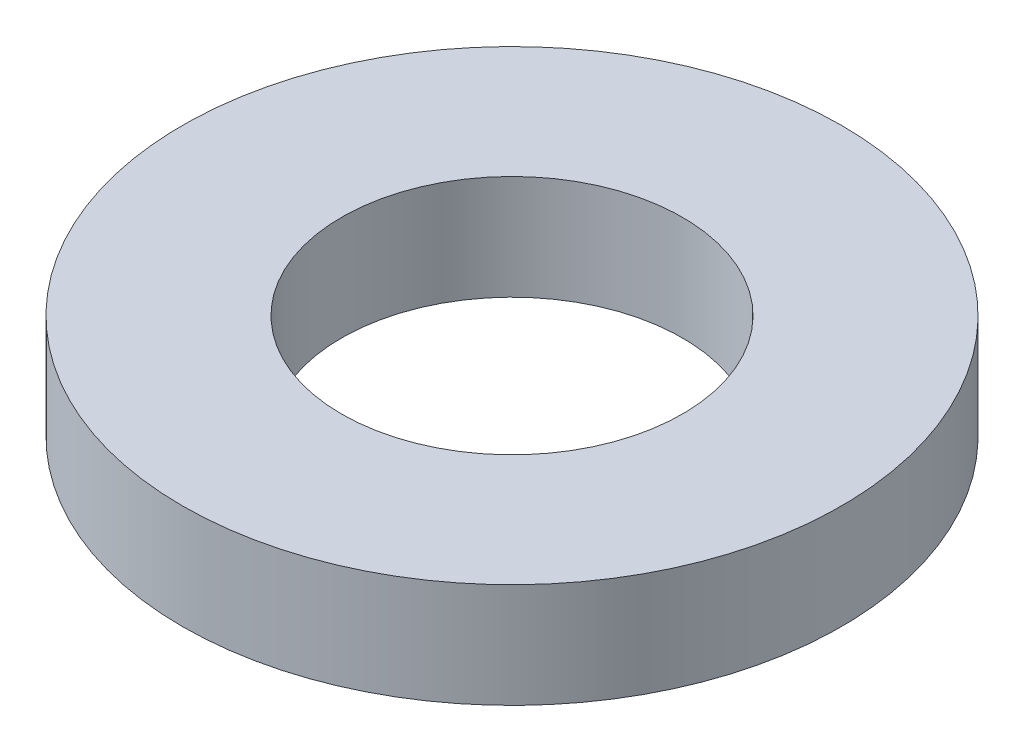
from build123d import *

# Parameters (mm, degrees)
SKETCH1_R           = 72.5
BOSS_EXTRUDE1_DEPTH = 23
SKETCH2_R           = 37.5
CUT_EXTRUDE1_DEPTH  = 106.078542053


with BuildPart() as part:
    # Sketch1 → Boss-Extrude1 (new body)
    with BuildSketch(Plane(origin=(0, 0, 0), x_dir=(1, 0, 0), z_dir=(0, 1, 0))):
        Circle(SKETCH1_R)
    extrude(amount=BOSS_EXTRUDE1_DEPTH)

    # Sketch2 → Cut-Extrude1 (cut, through all)
    with BuildSketch(Plane(origin=(0, 0, 0), x_dir=(1, 0, 0), z_dir=(0, 1, 0))):
        Circle(SKETCH2_R)
    extrude(amount=CUT_EXTRUDE1_DEPTH, mode=Mode.SUBTRACT)


solid = part.part
